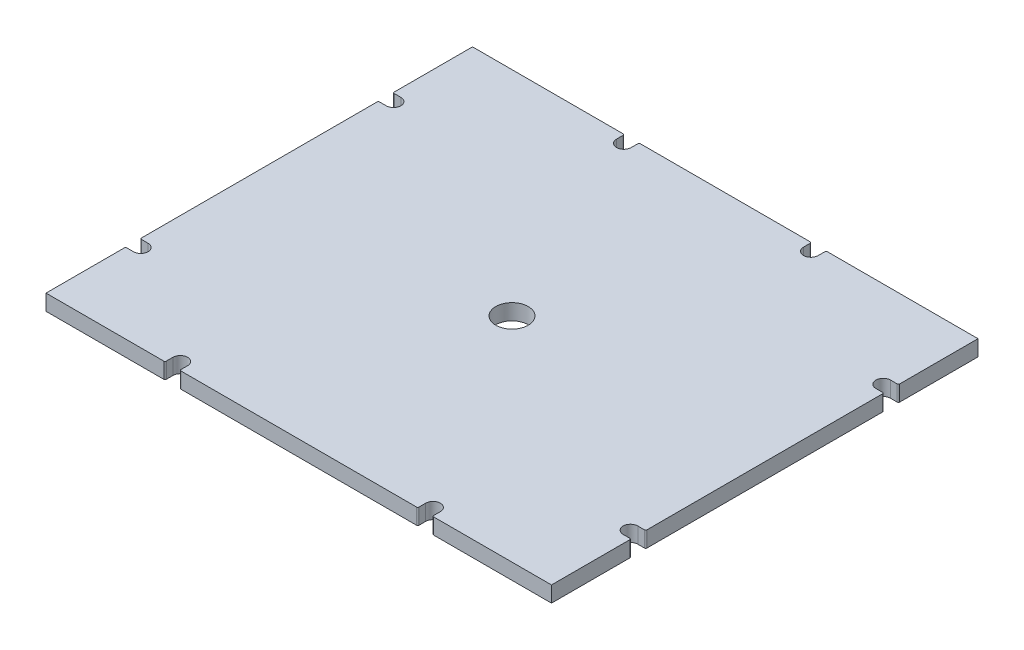
from build123d import *

# Parameters (mm, degrees)
SKETCH1_W               = 101.6
SKETCH1_H               = 85.725
BOSS_EXTRUDE1_DEPTH     = 3.175
CUT_EXTRUDE1_DEPTH      = 67.542576831
F_1_4_CLEARANCE_HOLE1_D = 6.5278
CUT_EXTRUDE2_DEPTH      = 67.542576831
FILLET1_R               = 0.254


with BuildPart() as part:
    # Sketch1 → Boss-Extrude1 (new body)
    with BuildSketch(Plane(origin=(0, 0, 0), x_dir=(1, 0, 0), z_dir=(0, 1, 0))):
        Rectangle(SKETCH1_W, SKETCH1_H)
    extrude(amount=BOSS_EXTRUDE1_DEPTH)

    # Sketch4 → Cut-Extrude1 (cut, through all)
    with BuildSketch(Plane.XZ):
        with BuildLine():
            Line((49.2125, -26.8732), (50.8, -26.8732))
            Line((50.8, -26.8732), (50.8, -23.9268))
            Line((50.8, -23.9268), (49.2125, -23.9268))
            ThreePointArc((49.2125, -23.9268), (47.7393, -25.4), (49.2125, -26.8732))
        make_face()
        with BuildLine():
            Line((49.2125, 26.8732), (50.8, 26.8732))
            Line((50.8, 26.8732), (50.8, 23.9268))
            Line((50.8, 23.9268), (49.2125, 23.9268))
            ThreePointArc((49.2125, 23.9268), (47.7393, 25.4), (49.2125, 26.8732))
        make_face()
        with BuildLine():
            Line((-49.2125, 26.8732), (-50.8, 26.8732))
            Line((-50.8, 26.8732), (-50.8, 23.9268))
            Line((-50.8, 23.9268), (-49.2125, 23.9268))
            ThreePointArc((-49.2125, 23.9268), (-47.7393, 25.4), (-49.2125, 26.8732))
        make_face()
        with BuildLine():
            Line((-49.2125, -23.9268), (-50.8, -23.9268))
            Line((-50.8, -23.9268), (-50.8, -26.8732))
            Line((-50.8, -26.8732), (-49.2125, -26.8732))
            ThreePointArc((-49.2125, -26.8732), (-47.7393, -25.4), (-49.2125, -23.9268))
        make_face()
    extrude(amount=-CUT_EXTRUDE1_DEPTH, mode=Mode.SUBTRACT)

    # 1/4 Clearance Hole1 (through all)
    with Locations(Plane(origin=(0, 0, 0), x_dir=(-1, 0, 0), z_dir=(0, -1, 0))):
        with Locations((0, 0)):
            Hole(F_1_4_CLEARANCE_HOLE1_D / 2)

    # Sketch9 → Cut-Extrude2 (cut, through all)
    with BuildSketch(Plane.XZ):
        with BuildLine():
            Line((17.3228, -41.275), (17.3228, -42.8625))
            Line((17.3228, -42.8625), (20.2692, -42.8625))
            Line((20.2692, -42.8625), (20.2692, -41.275))
            ThreePointArc((20.2692, -41.275), (18.796, -39.8018), (17.3228, -41.275))
        make_face()
        with BuildLine():
            Line((-20.2692, -41.275), (-20.2692, -42.8625))
            Line((-20.2692, -42.8625), (-17.3228, -42.8625))
            Line((-17.3228, -42.8625), (-17.3228, -41.275))
            ThreePointArc((-17.3228, -41.275), (-18.796, -39.8018), (-20.2692, -41.275))
        make_face()
        with BuildLine():
            Line((23.9268, 42.8625), (23.9268, 41.275))
            ThreePointArc((23.9268, 41.275), (25.4, 39.8018), (26.8732, 41.275))
            Line((26.8732, 41.275), (26.8732, 42.8625))
            Line((26.8732, 42.8625), (23.9268, 42.8625))
        make_face()
        with BuildLine():
            Line((-26.8732, 42.8625), (-26.8732, 41.275))
            ThreePointArc((-26.8732, 41.275), (-25.4, 39.8018), (-23.9268, 41.275))
            Line((-23.9268, 41.275), (-23.9268, 42.8625))
            Line((-23.9268, 42.8625), (-26.8732, 42.8625))
        make_face()
    extrude(amount=-CUT_EXTRUDE2_DEPTH, mode=Mode.SUBTRACT)

    # Fillet1
    fillet1_edges = [part.edges().sort_by_distance(p)[0] for p in [
        (20.2692, 1.5875, -42.8625),
        (17.3228, 1.5875, -42.8625),
        (-17.3228, 1.5875, -42.8625),
        (-20.2692, 1.5875, -42.8625),
        (-50.8, 1.5875, -23.9268),
        (-50.8, 1.5875, -26.8732),
        (-50.8, 1.5875, 26.8732),
        (-50.8, 1.5875, 23.9268),
        (-26.8732, 1.5875, 42.8625),
        (-23.9268, 1.5875, 42.8625),
        (26.8732, 1.5875, 42.8625),
        (23.9268, 1.5875, 42.8625),
        (50.8, 1.5875, 26.8732),
        (50.8, 1.5875, 23.9268),
        (50.8, 1.5875, -23.9268),
        (50.8, 1.5875, -26.8732),
    ]]
    fillet(fillet1_edges, radius=FILLET1_R)


solid = part.part
